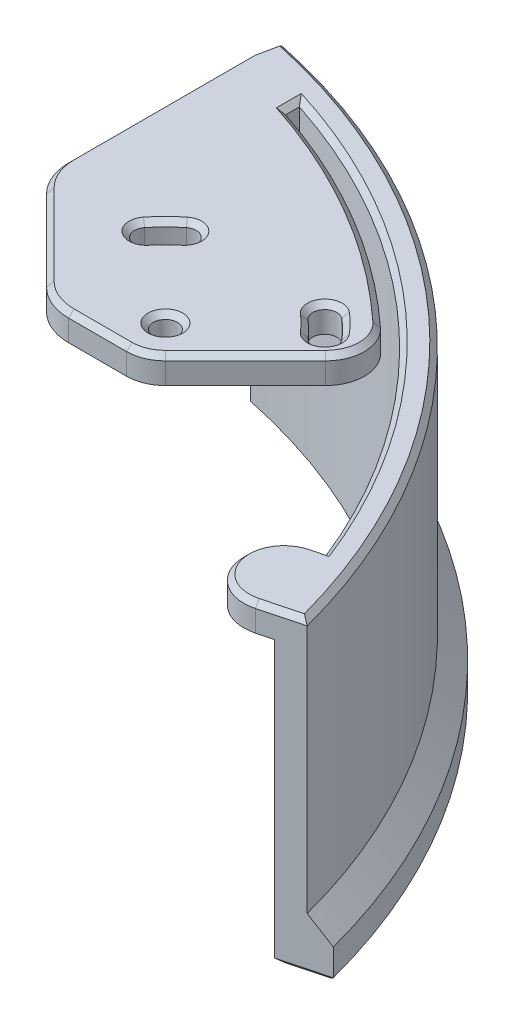
from build123d import *

# Parameters (mm, degrees)
BOSS_EXTRUDE1_DEPTH      = 5
BOSS_EXTRUDE1_DEPTH_BACK = 52.601
BOSS_EXTRUDE2_DEPTH      = 5
SKETCH3_W                = 4
SKETCH3_H                = 6
F_8_CLEARANCE_HOLE1_D    = 4.4958
CHAMFER1_SIZE            = 4
CUT_EXTRUDE7_DEPTH       = 189.558951211
BOSS_EXTRUDE10_START     = -5
BOSS_EXTRUDE10_DEPTH     = 5
CHAMFER4_SIZE            = 1


with BuildPart() as part:
    # Sketch1 → Boss-Extrude1 (new, two sides: drawn at the far end of the back side and taken through both)
    with BuildSketch(Plane(origin=(0, 0, 0), x_dir=(1, 0, 0), z_dir=(0, 1, 0)).offset(-BOSS_EXTRUDE1_DEPTH_BACK)):
        with BuildLine():
            Line((122.335390947, 32.191646773), (117.5, 30.919249667))
            ThreePointArc((117.5, 30.919249667), (83.736031712, 88.037077377), (25, 118.900168208))
            Line((25, 118.900168208), (26.028806584, 123.793179246))
            ThreePointArc((26.028806584, 123.793179246), (87.181958943, 91.660002372), (122.335390947, 32.191646773))
        make_face()
    extrude(amount=BOSS_EXTRUDE1_DEPTH + BOSS_EXTRUDE1_DEPTH_BACK)

    # Sketch2 → Boss-Extrude2 (add)
    with BuildSketch(Plane(origin=(0, 0, 0), x_dir=(1, 0, 0), z_dir=(0, 1, 0))):
        with BuildLine():
            Line((25, 118.900168208), (25, 84.894235624))
            ThreePointArc((25, 84.894235624), (25.761204675, 81.0674013), (27.928932188, 77.823167812))
            Line((27.928932188, 77.823167812), (43.071067812, 62.681032188))
            ThreePointArc((43.071067812, 62.681032188), (46.3153013, 60.513304675), (50.142135624, 59.7521))
            Line((50.142135624, 59.7521), (61, 59.7521))
            ThreePointArc((61, 59.7521), (63.773651249, 60.303813536), (66.125039239, 61.874960761))
            Line((66.125039239, 61.874960761), (81.125039239, 76.874960761))
            ThreePointArc((81.125039239, 76.874960761), (83.24659479, 82.137544003), (80.926866317, 87.315829447))
            ThreePointArc((80.926866317, 87.315829447), (60.589058557, 102.480133426), (37.5, 112.990980896))
            Line((37.5, 112.990980896), (37.5, 115.568161706))
            ThreePointArc((37.5, 115.568161706), (31.294377559, 117.400647073), (25, 118.900168208))
        make_face()
    extrude(amount=BOSS_EXTRUDE2_DEPTH)

    # Sweep1: sweep along a path in Sketch5
    with BuildLine(Plane.XZ.offset(52.601)) as sweep1_path:
        ThreePointArc((26.028806584, -123.793179246), (87.181958943, -91.660002372), (122.335390947, -32.191646773))
    # Sketch3 → Sweep1 (sweep)
    with BuildSketch(Plane(origin=(0, 0, 0), x_dir=(-0.20576131687242788, 0, 0.9786022074770342), z_dir=(-0.9786022074770342, 0, -0.20576131687242788))):
        with Locations((-128.5, -49.601)):
            Rectangle(SKETCH3_W, SKETCH3_H)
    sweep(path=sweep1_path.line)

    # #8 Clearance Hole1 (through all)
    with Locations(Plane(origin=(0, 5, 0), x_dir=(1, 0, 0), z_dir=(0, 1, 0))):
        with Locations((61, 67), (46, 52), (76, 52), (46, 82), (76, 82)):
            Hole(F_8_CLEARANCE_HOLE1_D / 2)

    # Chamfer1
    chamfer1_edges = [part.edges().sort_by_distance(p)[0] for p in [
        (87.181958943, -46.601, -91.660002372),
    ]]
    chamfer(chamfer1_edges, length=CHAMFER1_SIZE - 0.0001)  # a hair under: the kernel refuses the full size

    # Sketch21 → Cut-Extrude7 (cut, through all)
    with BuildSketch(Plane(origin=(0, 5, 0), x_dir=(1, 0, 0), z_dir=(0, 1, 0))):
        with BuildLine():
            ThreePointArc((46.481194337, 85.428989569), (44.410494667, 83.589505333), (42.571010431, 81.518805663))
            ThreePointArc((42.571010431, 81.518805663), (42.945660431, 78.361948651), (46.102517444, 78.736598651))
            ThreePointArc((46.102517444, 78.736598651), (47.589505333, 80.410494667), (49.263401349, 81.897482556))
            ThreePointArc((49.263401349, 81.897482556), (49.638051349, 85.054339569), (46.481194337, 85.428989569))
        make_face()
        with BuildLine():
            ThreePointArc((79.262817338, 81.727283432), (77.589505333, 83.589505333), (75.727283432, 85.262817338))
            ThreePointArc((75.727283432, 85.262817338), (72.566372961, 84.924064019), (72.90512628, 81.763153547))
            ThreePointArc((72.90512628, 81.763153547), (74.410494667, 80.410494667), (75.763153547, 78.90512628))
            ThreePointArc((75.763153547, 78.90512628), (78.924064019, 78.566372961), (79.262817338, 81.727283432))
        make_face()
    extrude(amount=-CUT_EXTRUDE7_DEPTH, mode=Mode.SUBTRACT)

    # Sketch32 → Boss-Extrude10 (add)
    with BuildSketch(Plane(origin=(0, 5, 0), x_dir=(1, 0, 0), z_dir=(0, 1, 0)).offset(BOSS_EXTRUDE10_START)):
        with BuildLine():
            Line((117.5, 30.919249667), (114.666962611, 30.173756984))
            ThreePointArc((114.666962611, 30.173756984), (105.505280532, 35.518247745), (110.849771294, 44.679929823))
            Line((110.849771294, 44.679929823), (112.783927672, 45.188888665))
            ThreePointArc((112.783927672, 45.188888665), (115.362808068, 38.127057514), (117.5, 30.919249667))
        make_face()
    extrude(amount=BOSS_EXTRUDE10_DEPTH)

    # Chamfer4
    chamfer4_edges = [part.edges().sort_by_distance(p)[0] for p in [
        (87.181958943, 5, -91.660002372),
        (44.410494667, 5, -83.589505333),
        (47.589505333, 5, -80.410494667),
        (49.638051349, 5, -85.054339569),
        (42.945660431, 5, -78.361948651),
        (74.410494667, 5, -80.410494667),
        (77.589505333, 5, -83.589505333),
        (121.851851852, -52.601, -32.064407063),
        (72.566372961, 5, -84.924064019),
        (78.924064019, 5, -78.566372961),
        (25.925925926, -52.601, -123.303878142),
        (83.736031712, -52.601, -88.037077377),
        (25.514403292, 5, -121.346673727),
        (111.816849483, 5, -44.934409244),
        (105.505280532, 5, -35.518247745),
        (82.973641884, 5, -88.755984319),
        (37.5, 5, -114.279571301),
        (25, 5, -101.897201916),
        (25.761204675, 5, -81.0674013),
        (35.5, 5, -70.2521),
        (46.3153013, 5, -60.513304675),
        (55.571067812, 5, -59.7521),
        (63.773651249, 5, -60.303813536),
        (73.625039239, 5, -69.374960761),
        (83.24659479, 5, -82.137544003),
        (60.589058557, 5, -102.480133426),
        (89.938700727, -52.601, -94.558342368),
        (118.501176779, 5, -31.182701878),
        (63.2479, 5, -67),
    ]]
    chamfer(chamfer4_edges, length=CHAMFER4_SIZE)


solid = part.part
